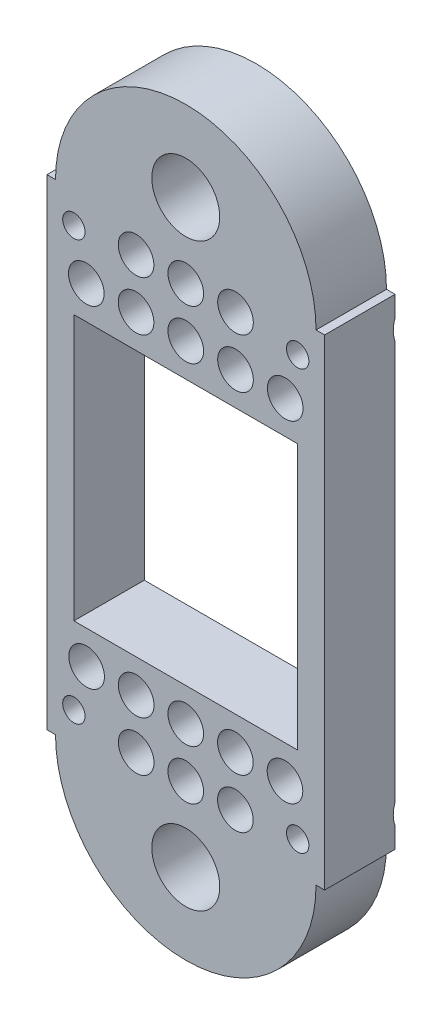
from build123d import *

# Parameters (mm, degrees)
SKETCH1_R                   = 1.35
SKETCH1_R_2                 = 4.1
SKETCH1_W                   = 27
SKETCH1_H                   = 32
BOSS_EXTRUDE1_DEPTH         = 8.5
SKETCH2_R                   = 2.15
CUT_EXTRUDE1_DEPTH          = 4.2
ADVANCEDHOLE1_OUTLINE_R     = 1.7
ADVANCEDHOLE1_OUTLINE_R_2   = 1.35
ADVANCEDHOLE1_DEPTH         = 1.77
ADVANCEDHOLE1_DRAFT         = 45
ADVANCEDHOLE1_2_OUTLINE_R   = 1.7
ADVANCEDHOLE1_2_OUTLINE_R_2 = 1.35
ADVANCEDHOLE1_2_DEPTH       = 1.77
ADVANCEDHOLE1_2_DRAFT       = 45
ADVANCEDHOLE1_3_OUTLINE_R   = 1.7
ADVANCEDHOLE1_3_OUTLINE_R_2 = 1.35
ADVANCEDHOLE1_3_DEPTH       = 1.77
ADVANCEDHOLE1_3_DRAFT       = 45
ADVANCEDHOLE1_4_OUTLINE_R   = 1.7
ADVANCEDHOLE1_4_OUTLINE_R_2 = 1.35
ADVANCEDHOLE1_4_DEPTH       = 1.77
ADVANCEDHOLE1_4_DRAFT       = 45


# Read off the part's stored shape, not the designer's step: AdvancedHole1
with BuildPart() as part:
    # Sketch1 → Boss-Extrude1 (new body)
    with BuildSketch(Plane.XY):
        with BuildLine():
            Line((-16.75, 29), (-15.715411776, 29))
            ThreePointArc((-15.715411776, 29), (0, 44.715411776), (15.715411776, 29))
            Line((15.715411776, 29), (16.75, 29))
            Line((16.75, 29), (16.75, 25))
            Line((16.75, 25), (16.75, -25))
            Line((16.75, -25), (16.75, -29))
            Line((16.75, -29), (15.715411776, -29))
            ThreePointArc((15.715411776, -29), (0, -44.715411776), (-15.715411776, -29))
            Line((-15.715411776, -29), (-16.75, -29))
            Line((-16.75, -29), (-16.75, -25))
            Line((-16.75, -25), (-16.75, 25))
            Line((-16.75, 25), (-16.75, 29))
        make_face()
        with Locations((-13.5, 25.3)):
            Circle(SKETCH1_R, mode=Mode.SUBTRACT)
        with Locations((13.5, -25.3)):
            Circle(SKETCH1_R, mode=Mode.SUBTRACT)
        with Locations((-13.5, -25.3)):
            Circle(SKETCH1_R, mode=Mode.SUBTRACT)
        with Locations((13.5, 25.3)):
            Circle(SKETCH1_R, mode=Mode.SUBTRACT)
        with Locations((0, 35)):
            Circle(SKETCH1_R_2, mode=Mode.SUBTRACT)
        with Locations(Location((0, -35, 0), (0, 0, 180))):
            Circle(SKETCH1_R_2, mode=Mode.SUBTRACT)
        Rectangle(SKETCH1_W, SKETCH1_H, mode=Mode.SUBTRACT)
    extrude(amount=BOSS_EXTRUDE1_DEPTH)

    # Sketch2 → Cut-Extrude1 (cut)
    with BuildSketch(Plane.XY.offset(8.5)):
        with Locations((-12, 20)):
            Circle(SKETCH2_R)
        with Locations((-6, 20)):
            Circle(SKETCH2_R)
        with Locations((0, 20)):
            Circle(SKETCH2_R)
        with Locations((6, 20)):
            Circle(SKETCH2_R)
        with Locations((12, 20)):
            Circle(SKETCH2_R)
        with Locations((-6, 26)):
            Circle(SKETCH2_R)
        with Locations((0, 26)):
            Circle(SKETCH2_R)
        with Locations((6, 26)):
            Circle(SKETCH2_R)
        with Locations((-11.967349369, -20)):
            Circle(SKETCH2_R)
        with Locations((-5.983674685, -20)):
            Circle(SKETCH2_R)
        with Locations((0, -20)):
            Circle(SKETCH2_R)
        with Locations((5.983674685, -20)):
            Circle(SKETCH2_R)
        with Locations((11.967349369, -20)):
            Circle(SKETCH2_R)
        with Locations((-5.983674685, -26)):
            Circle(SKETCH2_R)
        with Locations((0, -26)):
            Circle(SKETCH2_R)
        with Locations((5.983674685, -26)):
            Circle(SKETCH2_R)
    extrude(amount=-CUT_EXTRUDE1_DEPTH, mode=Mode.SUBTRACT)


with BuildPart() as advancedhole1_tool:
    # AdvancedHole1 outline → AdvancedHole1 (with draft: the straight prism first)
    with BuildSketch(Plane.XY.offset(1.77)):
        with Locations((-13.5, -25.3)):
            Circle(ADVANCEDHOLE1_OUTLINE_R)
        with Locations((-13.5, -25.3)):
            Circle(ADVANCEDHOLE1_OUTLINE_R_2, mode=Mode.SUBTRACT)
    extrude(amount=-ADVANCEDHOLE1_DEPTH)
    # AdvancedHole1: the draft: its side faces are tilted about the plane it starts from
    advancedhole1_sides = [advancedhole1_tool.faces().sort_by_distance(p)[0] for p in [
        (-15.2, -25.3, 0.885),
        (-14.85, -25.3, 0.885),
    ]]
    draft(advancedhole1_sides, Plane.XY.offset(1.77), ADVANCEDHOLE1_DRAFT)


with BuildPart() as part_1:
    add(part.part)

    # AdvancedHole1: cut by advancedhole1_tool
    add(advancedhole1_tool.part, mode=Mode.SUBTRACT)


with BuildPart() as advancedhole1_2_tool:
    # AdvancedHole1 2 outline → AdvancedHole1 2 (with draft: the straight prism first)
    with BuildSketch(Plane.XY.offset(1.77)):
        with Locations((13.5, -25.3)):
            Circle(ADVANCEDHOLE1_2_OUTLINE_R)
        with Locations((13.5, -25.3)):
            Circle(ADVANCEDHOLE1_2_OUTLINE_R_2, mode=Mode.SUBTRACT)
    extrude(amount=-ADVANCEDHOLE1_2_DEPTH)
    # AdvancedHole1 2: the draft: its side faces are tilted about the plane it starts from
    advancedhole1_2_sides = [advancedhole1_2_tool.faces().sort_by_distance(p)[0] for p in [
        (11.8, -25.3, 0.885),
        (12.15, -25.3, 0.885),
    ]]
    draft(advancedhole1_2_sides, Plane.XY.offset(1.77), ADVANCEDHOLE1_2_DRAFT)


with BuildPart() as part_2:
    add(part_1.part)

    # AdvancedHole1 2: cut by advancedhole1_2_tool
    add(advancedhole1_2_tool.part, mode=Mode.SUBTRACT)


with BuildPart() as advancedhole1_3_tool:
    # AdvancedHole1 3 outline → AdvancedHole1 3 (with draft: the straight prism first)
    with BuildSketch(Plane.XY.offset(1.77)):
        with Locations((13.5, 25.3)):
            Circle(ADVANCEDHOLE1_3_OUTLINE_R)
        with Locations((13.5, 25.3)):
            Circle(ADVANCEDHOLE1_3_OUTLINE_R_2, mode=Mode.SUBTRACT)
    extrude(amount=-ADVANCEDHOLE1_3_DEPTH)
    # AdvancedHole1 3: the draft: its side faces are tilted about the plane it starts from
    advancedhole1_3_sides = [advancedhole1_3_tool.faces().sort_by_distance(p)[0] for p in [
        (11.8, 25.3, 0.885),
        (12.15, 25.3, 0.885),
    ]]
    draft(advancedhole1_3_sides, Plane.XY.offset(1.77), ADVANCEDHOLE1_3_DRAFT)


with BuildPart() as part_3:
    add(part_2.part)

    # AdvancedHole1 3: cut by advancedhole1_3_tool
    add(advancedhole1_3_tool.part, mode=Mode.SUBTRACT)


with BuildPart() as advancedhole1_4_tool:
    # AdvancedHole1 4 outline → AdvancedHole1 4 (with draft: the straight prism first)
    with BuildSketch(Plane.XY.offset(1.77)):
        with Locations((-13.5, 25.3)):
            Circle(ADVANCEDHOLE1_4_OUTLINE_R)
        with Locations((-13.5, 25.3)):
            Circle(ADVANCEDHOLE1_4_OUTLINE_R_2, mode=Mode.SUBTRACT)
    extrude(amount=-ADVANCEDHOLE1_4_DEPTH)
    # AdvancedHole1 4: the draft: its side faces are tilted about the plane it starts from
    advancedhole1_4_sides = [advancedhole1_4_tool.faces().sort_by_distance(p)[0] for p in [
        (-15.2, 25.3, 0.885),
        (-14.85, 25.3, 0.885),
    ]]
    draft(advancedhole1_4_sides, Plane.XY.offset(1.77), ADVANCEDHOLE1_4_DRAFT)


with BuildPart() as part_4:
    add(part_3.part)

    # AdvancedHole1 4: cut by advancedhole1_4_tool
    add(advancedhole1_4_tool.part, mode=Mode.SUBTRACT)


solid = part_4.part
